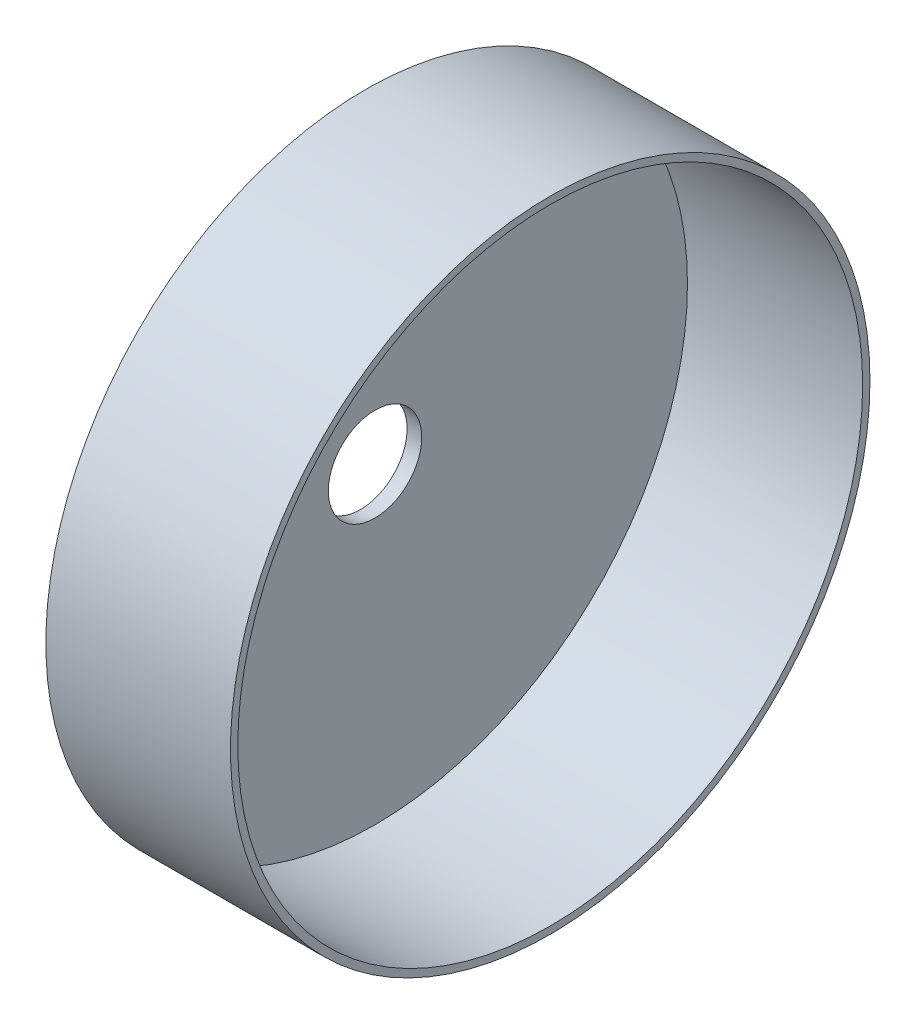
from build123d import *

# Parameters (mm, degrees)
SKETCH1_R           = 21.9
BOSS_EXTRUDE1_DEPTH = 1
SKETCH2_R           = 21.9
SKETCH2_R_2         = 21.4
BOSS_EXTRUDE2_DEPTH = 12
SKETCH3_R           = 3.2
CUT_EXTRUDE1_DEPTH  = 12
CHAMFER1_SIZE       = 2
CHAMFER1_SIZE2      = 0.352653961


with BuildPart() as part:
    # Sketch1 → Boss-Extrude1 (new body)
    with BuildSketch(Plane.YZ):
        Circle(SKETCH1_R)
    extrude(amount=BOSS_EXTRUDE1_DEPTH)

    # Sketch2 → Boss-Extrude2 (add)
    with BuildSketch(Plane.YZ.offset(1)):
        Circle(SKETCH2_R)
        Circle(SKETCH2_R_2, mode=Mode.SUBTRACT)
    extrude(amount=BOSS_EXTRUDE2_DEPTH)

    # Sketch3 → Cut-Extrude1 (cut)
    with BuildSketch(Plane(origin=(0, 0, 0), x_dir=(0, -1, 0), z_dir=(-1, 0, 0))):
        Circle(SKETCH3_R)
    extrude(amount=-CUT_EXTRUDE1_DEPTH, mode=Mode.SUBTRACT)

    # Chamfer1
    chamfer1_edges = [part.edges().sort_by_distance(p)[0] for p in [
        (0, -21.9, 0),
    ]]
    chamfer1_side = [part.faces().sort_by_distance(p)[0] for p in [
        (0, -21.28057446, 0),
    ]]
    chamfer(chamfer1_edges, length=CHAMFER1_SIZE, length2=CHAMFER1_SIZE2, reference=chamfer1_side[0])


solid = part.part
